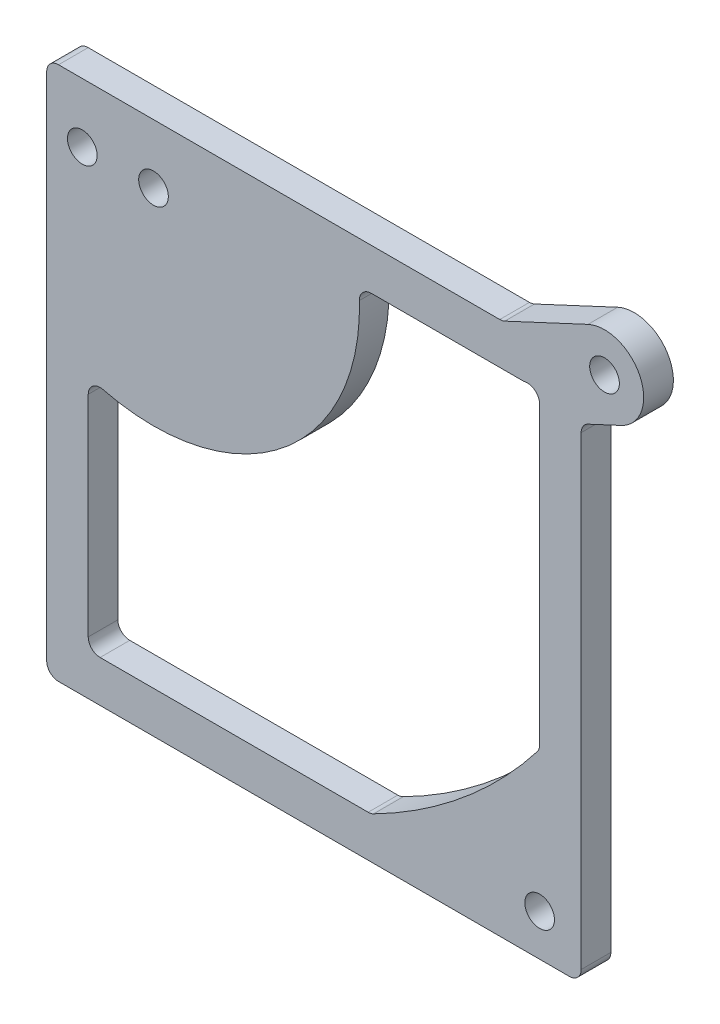
from build123d import *

# Parameters (mm, degrees)
SKETCH1_R           = 3.175
BOSS_EXTRUDE1_DEPTH = 3.175


with BuildPart() as part:
    # Sketch1 → Boss-Extrude1 (new, symmetric)
    with BuildSketch(Plane.XY):
        with BuildLine():
            Line((-54.61, -57.15941389), (54.700256121, -57.15941389))
            ThreePointArc((54.700256121, -57.15941389), (56.496307345, -56.415465115), (57.240256121, -54.61941389))
            Line((57.240256121, -54.61941389), (57.240256121, 44.894552652))
            ThreePointArc((57.240256121, 44.894552652), (57.638041849, 46.259293658), (58.706805736, 47.196574432))
            Line((58.706805736, 47.196574432), (65.77881461, 50.494306328))
            ThreePointArc((65.77881461, 50.494306328), (69.833100211, 61.633364469), (58.694042071, 65.68765007))
            Line((58.694042071, 65.68765007), (40.895338352, 57.387978221))
            ThreePointArc((40.895338352, 57.387978221), (40.371644587, 57.210208142), (39.821887967, 57.15))
            Line((39.821887967, 57.15), (-54.61941389, 57.15))
            ThreePointArc((-54.61941389, 57.15), (-56.408808489, 56.408808489), (-57.15, 54.61941389))
            Line((-57.15, 54.61941389), (-57.15, -54.61941389))
            ThreePointArc((-57.15, -54.61941389), (-56.406051224, -56.415465115), (-54.61, -57.15941389))
        make_face()
        with Locations((-49.53, 44.45)):
            Circle(SKETCH1_R, mode=Mode.SUBTRACT)
        with Locations((-34.29, 44.45)):
            Circle(SKETCH1_R, mode=Mode.SUBTRACT)
        with Locations((48.350256121, -48.26)):
            Circle(SKETCH1_R, mode=Mode.SUBTRACT)
        with Locations((62.23642834, 58.090978199)):
            Circle(SKETCH1_R, mode=Mode.SUBTRACT)
        with BuildLine():
            Line((-45.72, -48.26), (11.649731947, -48.26))
            ThreePointArc((11.649731947, -48.26), (12.242637746, -48.189830503), (12.802784567, -47.983198987))
            ThreePointArc((12.802784567, -47.983198987), (31.92275765, -35.409234642), (47.820712132, -18.949192317))
            ThreePointArc((47.820712132, -18.949192317), (48.214227655, -18.216955918), (48.350256121, -17.396882223))
            Line((48.350256121, -17.396882223), (48.350256121, 45.805946806))
            ThreePointArc((48.350256121, 45.805946806), (47.284671583, 47.835995499), (45.031498645, 48.26))
            Line((45.031498645, 48.26), (12.317525133, 48.26))
            ThreePointArc((12.317525133, 48.26), (10.497177192, 47.491421287), (9.77846758, 45.650813681))
            ThreePointArc((9.77846758, 45.650813681), (-6.735218946, 10.037708163), (-45.097323131, 1.710398281))
            ThreePointArc((-45.097323131, 1.710398281), (-47.280448774, 1.252050536), (-48.26, -0.752095073))
            Line((-48.26, -0.752095073), (-48.26, -45.72))
            ThreePointArc((-48.26, -45.72), (-47.516051224, -47.516051224), (-45.72, -48.26))
        make_face(mode=Mode.SUBTRACT)
    extrude(amount=BOSS_EXTRUDE1_DEPTH, both=True)


solid = part.part
